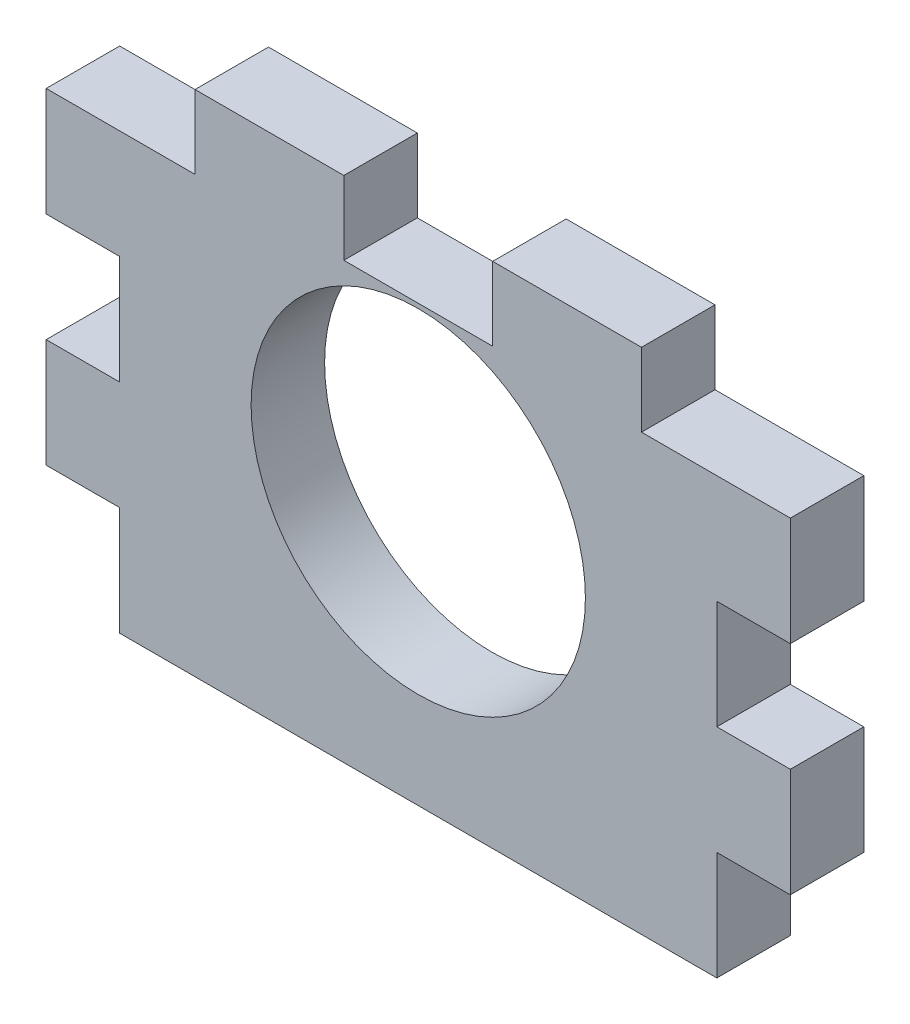
from build123d import *

# Parameters (mm, degrees)
SKETCH1_W                = 82.55
SKETCH1_H                = 56.4134
BOSS_EXTRUDE1_DEPTH      = 8.1534
CUT_EXTRUDE1_START       = -88.085249325
CUT_EXTRUDE1_OUTLINE_W   = 8.1534
CUT_EXTRUDE1_OUTLINE_H   = 8.1534
CUT_EXTRUDE1_DEPTH       = 16.51
CUT_EXTRUDE1_START_2     = -55.065249325
CUT_EXTRUDE1_2_OUTLINE_W = 8.1534
CUT_EXTRUDE1_2_OUTLINE_H = 8.1534
CUT_EXTRUDE1_2_DEPTH     = 16.51
CUT_EXTRUDE1_START_3     = -22.045249325
CUT_EXTRUDE1_3_OUTLINE_W = 8.1534
CUT_EXTRUDE1_3_OUTLINE_H = 8.1534
CUT_EXTRUDE1_3_DEPTH     = 16.51
SKETCH3_W                = 8.1534
SKETCH3_H                = 12.065106948
CUT_EXTRUDE2_DEPTH       = 99.056076844
SKETCH4_R                = 18.542
CUT_EXTRUDE3_DEPTH       = 99.056076844


# Read off the part's stored shape, not the designer's step: Cut-Extrude1
with BuildPart() as part:
    # Sketch1 → Boss-Extrude1 (new body)
    with BuildSketch(Plane.XY):
        with Locations((-46.810249325, -14.095842782)):
            Rectangle(SKETCH1_W, SKETCH1_H)
    extrude(amount=BOSS_EXTRUDE1_DEPTH)

    # Cut-Extrude1 outline → Cut-Extrude1 (cut)
    with BuildSketch(Plane.YZ.offset(CUT_EXTRUDE1_START)):
        with Locations((10.034157218, 4.0767)):
            Rectangle(CUT_EXTRUDE1_OUTLINE_W, CUT_EXTRUDE1_OUTLINE_H)
    extrude(amount=CUT_EXTRUDE1_DEPTH, mode=Mode.SUBTRACT)

    # Cut-Extrude1 2 outline → Cut-Extrude1 2 (cut)
    with BuildSketch(Plane.YZ.offset(CUT_EXTRUDE1_START_2)):
        with Locations((10.034157218, 4.0767)):
            Rectangle(CUT_EXTRUDE1_2_OUTLINE_W, CUT_EXTRUDE1_2_OUTLINE_H)
    extrude(amount=CUT_EXTRUDE1_2_DEPTH, mode=Mode.SUBTRACT)

    # Cut-Extrude1 3 outline → Cut-Extrude1 3 (cut)
    with BuildSketch(Plane.YZ.offset(CUT_EXTRUDE1_START_3)):
        with Locations((10.034157218, 4.0767)):
            Rectangle(CUT_EXTRUDE1_3_OUTLINE_W, CUT_EXTRUDE1_3_OUTLINE_H)
    extrude(amount=CUT_EXTRUDE1_3_DEPTH, mode=Mode.SUBTRACT)

    # Sketch3 → Cut-Extrude2 (cut, through all)
    with BuildSketch(Plane.XY.offset(8.1534)):
        with Locations((-84.008549325, -36.269989308)):
            Rectangle(SKETCH3_W, SKETCH3_H)
        with Locations((-84.008549325, -12.139775411)):
            Rectangle(SKETCH3_W, SKETCH3_H)
        with Locations((-9.611949325, -36.269989308)):
            Rectangle(SKETCH3_W, SKETCH3_H)
        with Locations((-9.611949325, -12.139775411)):
            Rectangle(SKETCH3_W, SKETCH3_H)
    extrude(amount=-CUT_EXTRUDE2_DEPTH, mode=Mode.SUBTRACT)

    # Sketch4 → Cut-Extrude3 (cut, through all)
    with BuildSketch(Plane(origin=(0, 0, 0), x_dir=(-1, 0, 0), z_dir=(0, 0, -1))):
        with Locations((46.810249325, -13.092542782)):
            Circle(SKETCH4_R)
    extrude(amount=-CUT_EXTRUDE3_DEPTH, mode=Mode.SUBTRACT)


solid = part.part
